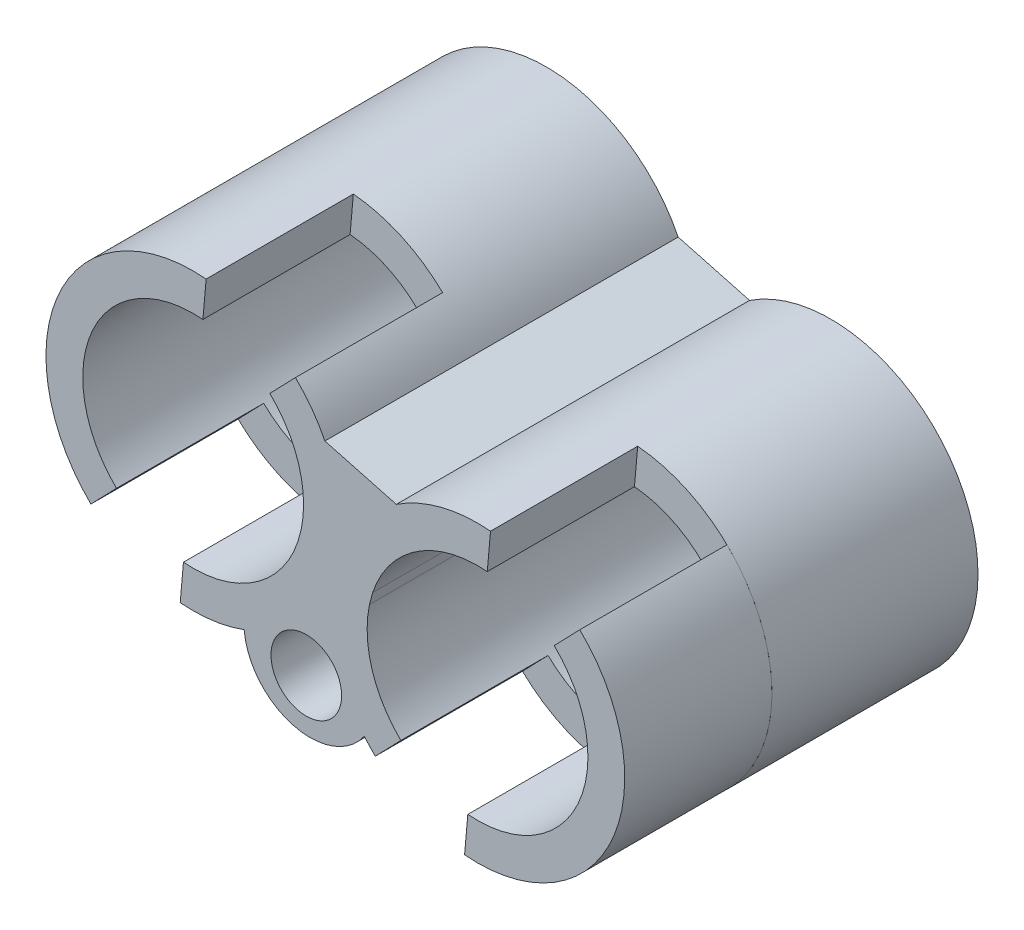
from build123d import *
from build123d.topology import SkipClean

# Parameters (mm, degrees)
SKETCH1_R             = 7.5
SKETCH1_R_2           = 3.285
BOSS_EXTRUDE1_DEPTH   = 2
BOSS_EXTRUDE1_2_DEPTH = 2
SKETCH1_3_R           = 10
SKETCH1_3_R_2         = 7.5
BOSS_EXTRUDE2_DEPTH   = 14
BOSS_EXTRUDE3_DEPTH   = 10
BOSS_EXTRUDE4_DEPTH   = 24
SKETCH5_R             = 4.496880173
BOSS_EXTRUDE5_DEPTH   = 24
SKETCH6_R             = 2.4
CUT_EXTRUDE1_DEPTH    = 10


with BuildPart() as part:
    # Sketch1 → Boss-Extrude1 (new body)
    with BuildSketch(Plane.XY):
        Circle(SKETCH1_R)
        Circle(SKETCH1_R_2, mode=Mode.SUBTRACT)
    extrude(amount=BOSS_EXTRUDE1_DEPTH)

    # Sketch1<3> → Boss-Extrude2 (add)
    # profile 1 of 2: a face of its own
    with BuildSketch(Plane.XY):
        Circle(SKETCH1_3_R)
        Circle(SKETCH1_3_R_2, mode=Mode.SUBTRACT)
    # profile 2 of 2: a face of its own
    with BuildSketch(Plane.XY):
        with Locations((19.318516526, -5.176380902)):
            Circle(SKETCH1_3_R)
        with Locations((19.318516526, -5.176380902)):
            Circle(SKETCH1_3_R_2, mode=Mode.SUBTRACT)
    extrude(amount=BOSS_EXTRUDE2_DEPTH)


with BuildPart() as body_2:
    # Sketch1 → Boss-Extrude1 2 (new body)
    with BuildSketch(Plane.XY):
        with Locations((19.318516526, -5.176380902)):
            Circle(SKETCH1_R)
        with Locations((19.318516526, -5.176380902)):
            Circle(SKETCH1_R_2, mode=Mode.SUBTRACT)
    extrude(amount=BOSS_EXTRUDE1_2_DEPTH)



with BuildPart() as boss_extrude2_piece_1:
    # of the separate pieces the step leaves, piece 1, a body of its own (boss_extrude2_pieces)
    add(part.part.solids().sort_by_distance((3.285, 0, 0))[0])

    # Sketch2 → Boss-Extrude3 (add)
    with SkipClean():  # the faces are left unmerged after this step: merging them gives an invalid solid
        with BuildSketch(Plane.XY.offset(14)):
            with BuildLine():
                ThreePointArc((0.880723614, 9.961140794), (-9.097879067, 4.150734451), (-6.945976325, -7.193984493))
                Line((-6.945976325, -7.193984493), (-5.209482244, -5.39548837))
                ThreePointArc((-5.209482244, -5.39548837), (-6.8234093, 3.113050838), (0.66054271, 7.470855595))
                Line((0.66054271, 7.470855595), (0.880723614, 9.961140794))
            make_face()
            with BuildLine():
                ThreePointArc((20.199240139, 4.784759892), (13.586521544, 3.017777598), (9.659258283, -2.588190376))
                ThreePointArc((9.659258283, -2.588190376), (9.68232481, -7.849171431), (12.372540201, -12.370365396))
                Line((12.372540201, -12.370365396), (14.109034282, -10.571869272))
                ThreePointArc((14.109034282, -10.571869272), (12.495107225, -2.063330064), (19.979059236, 2.294474693))
                Line((19.979059236, 2.294474693), (20.199240139, 4.784759892))
            make_face()
            with BuildLine():
                Line((-0.66054271, -7.470855595), (-0.880723614, -9.961140794))
                ThreePointArc((-0.880723614, -9.961140794), (5.731995045, -8.194158456), (9.659258283, -2.588190376))
                ThreePointArc((9.659258283, -2.588190376), (9.636191695, 2.672790603), (6.945976325, 7.193984493))
                Line((6.945976325, 7.193984493), (5.209482244, 5.39548837))
                ThreePointArc((5.209482244, 5.39548837), (6.8234093, -3.113050838), (-0.66054271, -7.470855595))
            make_face()
            with BuildLine():
                ThreePointArc((18.437792912, -15.137521696), (28.416395593, -9.327115353), (26.264492851, 2.017603591))
                Line((26.264492851, 2.017603591), (24.52799877, 0.219107468))
                ThreePointArc((24.52799877, 0.219107468), (26.141925826, -8.28943174), (18.657973816, -12.647236497))
                Line((18.657973816, -12.647236497), (18.437792912, -15.137521696))
            make_face()
        extrude(amount=BOSS_EXTRUDE3_DEPTH)


with BuildPart() as boss_extrude2_piece_2:
    # of the separate pieces the step leaves, piece 2, a body of its own (boss_extrude2_pieces)
    add(part.part.solids().sort_by_distance((29.318516526, -5.176380902, 0))[0])


with BuildPart() as boss_extrude3_piece_1:
    # of the separate pieces the step leaves, piece 1, a body of its own (boss_extrude3_pieces)
    add(boss_extrude2_piece_1.part.solids().sort_by_distance((3.285, 0, 0))[0])


with BuildPart() as boss_extrude3_piece_2:
    # of the separate pieces the step leaves, piece 2, a body of its own (boss_extrude3_pieces)
    add(boss_extrude2_piece_1.part.solids().sort_by_distance((26.264492851, 2.017603591, 14))[0])


with BuildPart() as boss_extrude3_piece_3:
    # of the separate pieces the step leaves, piece 3, a body of its own (boss_extrude3_pieces)
    add(boss_extrude2_piece_1.part.solids().sort_by_distance((20.199240139, 4.784759892, 14))[0])


with BuildPart() as body_2_1:
    with SkipClean():  # the faces are left unmerged after this step: merging them gives an invalid solid
        add(body_2.part)

        add(boss_extrude2_piece_2.part)  # Boss-Extrude4 merges Boss-Extrude2 piece 2

        add(boss_extrude3_piece_1.part)  # Boss-Extrude4 merges Boss-Extrude3 piece 1

        add(boss_extrude3_piece_3.part)  # Boss-Extrude4 merges Boss-Extrude3 piece 3
        # Sketch4 → Boss-Extrude4 (add)
        with BuildSketch(Plane.XY.offset(24)):
            Polygon((13.800709497, 3.163511519), (8.948507271, 4.463655187), (5.517807029, -8.339892421), (10.370009255, -9.640036089), align=None)
        extrude(amount=-BOSS_EXTRUDE4_DEPTH)

    # Sketch5 → Boss-Extrude5 (add)
    with SkipClean():  # the faces are left unmerged after this step: merging them gives an invalid solid
        with BuildSketch(Plane.XY.offset(24)):
            with Locations((7.943908142, -8.989964255)):
                Circle(SKETCH5_R)
        extrude(amount=-BOSS_EXTRUDE5_DEPTH)

    # Sketch6 → Cut-Extrude1 (cut)
    with SkipClean():  # the faces are left unmerged after this step: merging them gives an invalid solid
        with BuildSketch(Plane.XY.offset(24)):
            with Locations((7.685089097, -9.955890081)):
                Circle(SKETCH6_R)
        extrude(amount=-CUT_EXTRUDE1_DEPTH, mode=Mode.SUBTRACT)


solid = Compound([boss_extrude3_piece_2.part, body_2_1.part])
